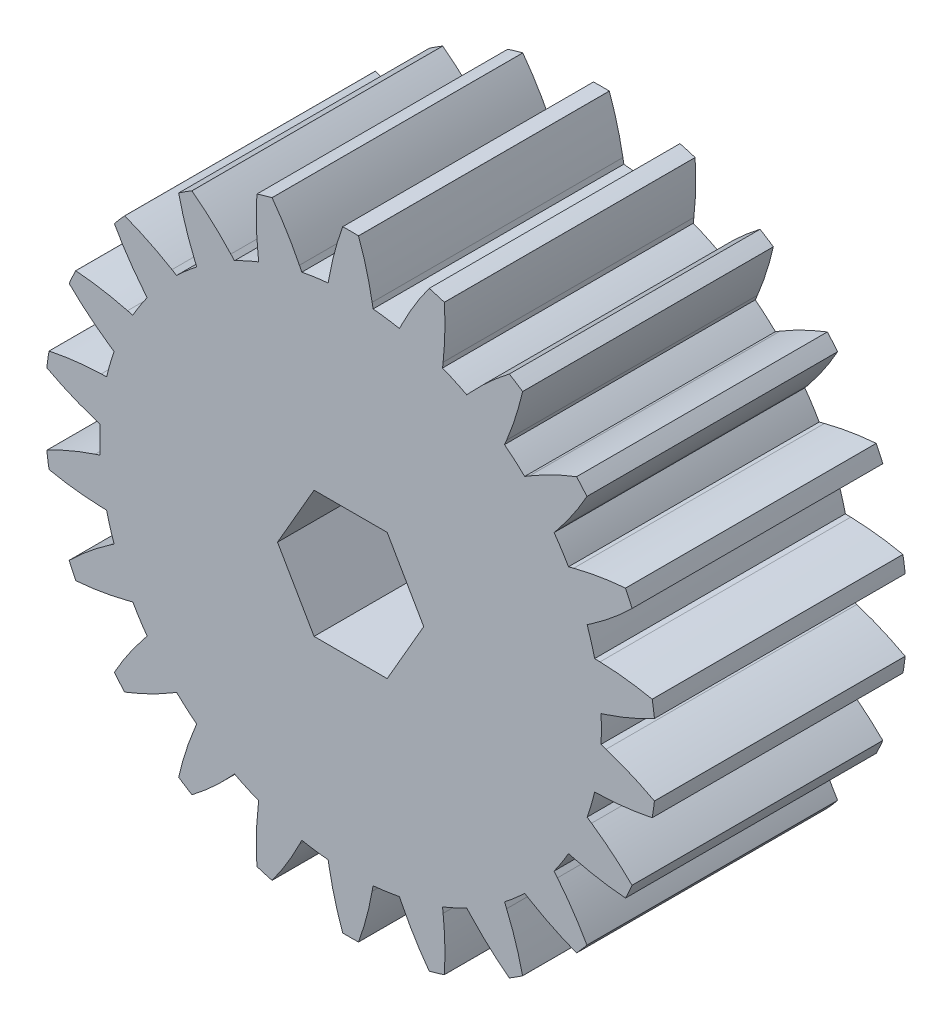
from build123d import *

# Parameters (mm, degrees)
BOSS_EXTRUDE1_DEPTH = 25.4
SKETCH2_OUTSIDE_W   = 81.92
SKETCH2_OUTSIDE_H   = 82.19
SKETCH2_OUTSIDE_R   = 30.988
CUT_EXTRUDE1_DEPTH  = 51.570187972
CHAMFER1_SIZE       = 2.54
FILLET1_R           = 30.48
CUT_EXTRUDE2_DEPTH  = 25.4


with BuildPart() as part:
    # Sketch1 → Boss-Extrude1 (new body)
    with BuildSketch(Plane.XY):
        with BuildLine():
            Line((-2.273288832, 25.298066287), (-1.27, 30.988))
            Line((-1.27, 30.988), (1.27, 30.988))
            Line((1.27, 30.988), (2.273288832, 25.298066287))
            ThreePointArc((2.273288832, 25.298066287), (3.614796892, 25.141464624), (4.946084237, 24.913776324))
            Line((4.946084237, 24.913776324), (7.511772395, 30.090568614))
            Line((7.511772395, 30.090568614), (9.948884548, 29.374967919))
            Line((9.948884548, 29.374967919), (9.30849356, 23.632857374))
            ThreePointArc((9.30849356, 23.632857374), (10.55154133, 23.104652682), (11.764754977, 22.511120371))
            Line((11.764754977, 22.511120371), (15.684985665, 26.755378314))
            Line((15.684985665, 26.755378314), (17.821769638, 25.382150637))
            Line((17.821769638, 25.382150637), (15.589579499, 20.053054906))
            ThreePointArc((15.589579499, 20.053054906), (16.633462642, 19.196039189), (17.630315236, 18.284747324))
            Line((17.630315236, 18.284747324), (22.587494678, 21.252626383))
            Line((22.587494678, 21.252626383), (24.250840942, 19.333022464))
            Line((24.250840942, 19.333022464), (20.607690422, 14.848673189))
            ThreePointArc((20.607690422, 14.848673189), (21.367839734, 13.732276763), (22.067572206, 12.577052792))
            Line((22.067572206, 12.577052792), (27.660099206, 14.028113057))
            Line((27.660099206, 14.028113057), (28.715253339, 11.717647789))
            Line((28.715253339, 11.717647789), (23.956288825, 8.44134028))
            ThreePointArc((23.956288825, 8.44134028), (24.37112153, 7.156006944), (24.717045717, 5.850440242))
            Line((24.717045717, 5.850440242), (30.491846996, 5.66712544))
            Line((30.491846996, 5.66712544), (30.853326686, 3.152978977))
            Line((30.853326686, 3.152978977), (25.364091182, 1.350140183))
            ThreePointArc((25.364091182, 1.350140183), (25.4, 0), (25.364091182, -1.350140183))
            Line((25.364091182, -1.350140183), (30.853326686, -3.152978977))
            Line((30.853326686, -3.152978977), (30.491846996, -5.66712544))
            Line((30.491846996, -5.66712544), (24.717045717, -5.850440242))
            ThreePointArc((24.717045717, -5.850440242), (24.37112153, -7.156006944), (23.956288825, -8.44134028))
            Line((23.956288825, -8.44134028), (28.715253339, -11.717647789))
            Line((28.715253339, -11.717647789), (27.660099206, -14.028113057))
            Line((27.660099206, -14.028113057), (22.067572206, -12.577052792))
            ThreePointArc((22.067572206, -12.577052792), (21.367839734, -13.732276763), (20.607690422, -14.848673189))
            Line((20.607690422, -14.848673189), (24.250840942, -19.333022464))
            Line((24.250840942, -19.333022464), (22.587494678, -21.252626383))
            Line((22.587494678, -21.252626383), (17.630315236, -18.284747324))
            ThreePointArc((17.630315236, -18.284747324), (16.633462642, -19.196039189), (15.589579499, -20.053054906))
            Line((15.589579499, -20.053054906), (17.821769638, -25.382150637))
            Line((17.821769638, -25.382150637), (15.684985665, -26.755378314))
            Line((15.684985665, -26.755378314), (11.764754977, -22.511120371))
            ThreePointArc((11.764754977, -22.511120371), (10.55154133, -23.104652682), (9.30849356, -23.632857374))
            Line((9.30849356, -23.632857374), (9.948884548, -29.374967919))
            Line((9.948884548, -29.374967919), (7.511772395, -30.090568614))
            Line((7.511772395, -30.090568614), (4.946084237, -24.913776324))
            ThreePointArc((4.946084237, -24.913776324), (3.614796892, -25.141464624), (2.273288832, -25.298066287))
            Line((2.273288832, -25.298066287), (1.27, -30.988))
            Line((1.27, -30.988), (-1.27, -30.988))
            Line((-1.27, -30.988), (-2.273288832, -25.298066287))
            ThreePointArc((-2.273288832, -25.298066287), (-3.614796892, -25.141464624), (-4.946084237, -24.913776324))
            Line((-4.946084237, -24.913776324), (-7.511772395, -30.090568614))
            Line((-7.511772395, -30.090568614), (-9.948884548, -29.374967919))
            Line((-9.948884548, -29.374967919), (-9.30849356, -23.632857374))
            ThreePointArc((-9.30849356, -23.632857374), (-10.55154133, -23.104652682), (-11.764754977, -22.511120371))
            Line((-11.764754977, -22.511120371), (-15.684985665, -26.755378314))
            Line((-15.684985665, -26.755378314), (-17.821769638, -25.382150637))
            Line((-17.821769638, -25.382150637), (-15.589579499, -20.053054906))
            ThreePointArc((-15.589579499, -20.053054906), (-16.633462642, -19.196039189), (-17.630315236, -18.284747324))
            Line((-17.630315236, -18.284747324), (-22.587494678, -21.252626383))
            Line((-22.587494678, -21.252626383), (-24.250840942, -19.333022464))
            Line((-24.250840942, -19.333022464), (-20.607690422, -14.848673189))
            ThreePointArc((-20.607690422, -14.848673189), (-21.367839734, -13.732276763), (-22.067572206, -12.577052792))
            Line((-22.067572206, -12.577052792), (-27.660099206, -14.028113057))
            Line((-27.660099206, -14.028113057), (-28.715253339, -11.717647789))
            Line((-28.715253339, -11.717647789), (-23.956288825, -8.44134028))
            ThreePointArc((-23.956288825, -8.44134028), (-24.37112153, -7.156006944), (-24.717045717, -5.850440242))
            Line((-24.717045717, -5.850440242), (-30.491846996, -5.66712544))
            Line((-30.491846996, -5.66712544), (-30.853326686, -3.152978977))
            Line((-30.853326686, -3.152978977), (-25.364091182, -1.350140183))
            ThreePointArc((-25.364091182, -1.350140183), (-25.4, 0), (-25.364091182, 1.350140183))
            Line((-25.364091182, 1.350140183), (-30.853326686, 3.152978977))
            Line((-30.853326686, 3.152978977), (-30.491846996, 5.66712544))
            Line((-30.491846996, 5.66712544), (-24.717045717, 5.850440242))
            ThreePointArc((-24.717045717, 5.850440242), (-24.37112153, 7.156006944), (-23.956288825, 8.44134028))
            Line((-23.956288825, 8.44134028), (-28.715253339, 11.717647789))
            Line((-28.715253339, 11.717647789), (-27.660099206, 14.028113057))
            Line((-27.660099206, 14.028113057), (-22.067572206, 12.577052792))
            ThreePointArc((-22.067572206, 12.577052792), (-21.367839734, 13.732276763), (-20.607690422, 14.848673189))
            Line((-20.607690422, 14.848673189), (-24.250840942, 19.333022464))
            Line((-24.250840942, 19.333022464), (-22.587494678, 21.252626383))
            Line((-22.587494678, 21.252626383), (-17.630315236, 18.284747324))
            ThreePointArc((-17.630315236, 18.284747324), (-16.633462642, 19.196039189), (-15.589579499, 20.053054906))
            Line((-15.589579499, 20.053054906), (-17.821769638, 25.382150637))
            Line((-17.821769638, 25.382150637), (-15.684985665, 26.755378314))
            Line((-15.684985665, 26.755378314), (-11.764754977, 22.511120371))
            ThreePointArc((-11.764754977, 22.511120371), (-10.55154133, 23.104652682), (-9.30849356, 23.632857374))
            Line((-9.30849356, 23.632857374), (-9.948884548, 29.374967919))
            Line((-9.948884548, 29.374967919), (-7.511772395, 30.090568614))
            Line((-7.511772395, 30.090568614), (-4.946084237, 24.913776324))
            ThreePointArc((-4.946084237, 24.913776324), (-3.614796892, 25.141464624), (-2.273288832, 25.298066287))
        make_face()
    extrude(amount=BOSS_EXTRUDE1_DEPTH)

    # Sketch2 outside → Cut-Extrude1 (cut, through all)
    with BuildSketch(Plane.XY.offset(25.4)):
        Rectangle(SKETCH2_OUTSIDE_W, SKETCH2_OUTSIDE_H)
        Circle(SKETCH2_OUTSIDE_R, mode=Mode.SUBTRACT)
    extrude(amount=-CUT_EXTRUDE1_DEPTH, mode=Mode.SUBTRACT)

    # Chamfer1
    # the kernel refuses this chamfer: 2.54, 0.476916629 mm, written as the material it takes off along each edge
    with BuildSketch(Plane(origin=(-7.499946846, 30.066708189, -6.600288543), x_dir=(0.4440666126057047, -0.8959937742913703, 0), z_dir=(0, 0, 1)), Plane(origin=(-22.564646474, 21.238947091, -6.600288543), x_dir=(0.8579834132349209, -0.5136773915735, 0), z_dir=(0, 0, 1)), Plane(origin=(-27.634322612, 14.021424955, -6.600288543), x_dir=(0.9679487013963278, -0.2511479871811889, 0), z_dir=(0, 0, 1)), Plane(origin=(-30.46523028, 5.667970358, -6.600288543), x_dir=(0.9994965423831886, 0.03172793349795939, 0), z_dir=(0, 0, 1)), Plane(origin=(-30.828026174, -3.144669488, -6.600288543), x_dir=(0.9500711177409771, 0.31203344569839025, 0), z_dir=(0, 0, 1)), Plane(origin=(-28.693318729, -11.702546915, -6.600288543), x_dir=(0.8236765814298862, 0.5670598638626932, 0), z_dir=(0, 0, 1)), Plane(origin=(-24.234049247, -19.312353588, -6.600288543), x_dir=(0.6305526670845901, 0.776146464291702, 0), z_dir=(0, 0, 1)), Plane(origin=(-17.81148122, -25.357588228, -6.600288543), x_dir=(0.3863451256931978, 0.9223542941045525, 0), z_dir=(0, 0, 1)), Plane(origin=(-9.945932913, -29.348501878, -6.600288543), x_dir=(0.11083819990105796, 0.9938384644612489, 0), z_dir=(0, 0, 1)), Plane(origin=(-1.274624272, -30.961774448, -6.600288543), x_dir=(-0.1736481776668918, 0.9848077530122149, 0), z_dir=(0, 0, 1)), Plane(origin=(7.499946846, -30.066708189, -6.600288543), x_dir=(-0.44406661260571395, 0.8959937742913657, 0), z_dir=(0, 0, 1)), Plane(origin=(15.666916875, -26.735816046, -6.600288543), x_dir=(-0.6785094115571405, 0.7345917086575257, 0), z_dir=(0, 0, 1)), Plane(origin=(22.564646474, -21.238947091, -6.600288543), x_dir=(-0.8579834132349822, 0.5136773915733978, 0), z_dir=(0, 0, 1)), Plane(origin=(27.634322612, -14.021424955, -6.600288543), x_dir=(-0.9679487013963594, 0.2511479871810671, 0), z_dir=(0, 0, 1)), Plane(origin=(30.46523028, -5.667970358, -6.600288543), x_dir=(-0.9994965423831847, -0.03172793349808035, 0), z_dir=(0, 0, 1)), Plane(origin=(30.828026174, 3.144669488, -6.600288543), x_dir=(-0.9500711177409777, -0.31203344569838826, 0), z_dir=(0, 0, 1)), Plane(origin=(28.693318729, 11.702546915, -6.600288543), x_dir=(-0.823676581429892, -0.5670598638626849, 0), z_dir=(0, 0, 1)), Plane(origin=(24.234049247, 19.312353588, -6.600288543), x_dir=(-0.6305526670846017, -0.7761464642916925, 0), z_dir=(0, 0, 1)), Plane(origin=(17.81148122, 25.357588228, -6.600288543), x_dir=(-0.3863451256932244, -0.9223542941045413, 0), z_dir=(0, 0, 1)), Plane(origin=(9.945932913, 29.348501878, -6.600288543), x_dir=(-0.1108381999011183, -0.9938384644612422, 0), z_dir=(0, 0, 1)), Plane(origin=(1.274624272, 30.961774448, -6.600288543), x_dir=(0.1736481776669276, -0.9848077530122086, 0), z_dir=(0, 0, 1))) as chamfer1_piece_1:
        with BuildLine():
            Line((CHAMFER1_SIZE, 0), (-0.098180868, -0.465182467))
            ThreePointArc((-0.098180868, -0.465182467), (-0.053887012, -0.250930237), (0, 0))
            Line((0, 0), (CHAMFER1_SIZE, 0))
        make_face()
    extrude(amount=38.600577086, mode=Mode.SUBTRACT)
    with BuildSketch(Plane(origin=(-1.274624272, 30.961774448, -6.600288543), x_dir=(0.9994398259990054, 0.03346691212343495, 0), z_dir=(0, 0, 1)), Plane(origin=(-9.945932913, 29.348501878, -6.600288543), x_dir=(0.9495267718744262, 0.3136860046188405, 0), z_dir=(0, 0, 1)), Plane(origin=(-17.81148122, 25.357588228, -6.600288543), x_dir=(0.8226887057457318, 0.5684921225825494, 0), z_dir=(0, 0, 1)), Plane(origin=(-24.234049247, 19.312353588, -6.600288543), x_dir=(0.6292012933956386, 0.7772423897274617, 0), z_dir=(0, 0, 1)), Plane(origin=(-28.693318729, 11.702546915, -6.600288543), x_dir=(0.3847397342588159, 0.923025100895125, 0), z_dir=(0, 0, 1)), Plane(origin=(-30.828026174, 3.144669488, -6.600288543), x_dir=(0.10910884998763513, 0.9940298078299139, 0), z_dir=(0, 0, 1)), Plane(origin=(-30.46523028, -5.667970358, -6.600288543), x_dir=(-0.17536138441422428, 0.9845041314572156, 0), z_dir=(0, 0, 1)), Plane(origin=(-27.634322612, -14.021424955, -6.600288543), x_dir=(-0.4456248823651576, 0.8952197854253666, 0), z_dir=(0, 0, 1)), Plane(origin=(-22.564646474, -21.238947091, -6.600288543), x_dir=(-0.6797865025800756, 0.7334100564554246, 0), z_dir=(0, 0, 1)), Plane(origin=(-15.666916875, -26.735816046, -6.600288543), x_dir=(-0.8588758632019615, 0.5121838064690113, 0), z_dir=(0, 0, 1)), Plane(origin=(-7.499946846, -30.066708189, -6.600288543), x_dir=(-0.9683842093186641, 0.24946347055684484, 0), z_dir=(0, 0, 1)), Plane(origin=(1.274624272, -30.961774448, -6.600288543), x_dir=(-0.999439825999006, -0.033466912123419526, 0), z_dir=(0, 0, 1)), Plane(origin=(9.945932913, -29.348501878, -6.600288543), x_dir=(-0.9495267718744267, -0.31368600461883944, 0), z_dir=(0, 0, 1)), Plane(origin=(17.81148122, -25.357588228, -6.600288543), x_dir=(-0.8226887057457212, -0.568492122582565, 0), z_dir=(0, 0, 1)), Plane(origin=(24.234049247, -19.312353588, -6.600288543), x_dir=(-0.6292012933956287, -0.7772423897274697, 0), z_dir=(0, 0, 1)), Plane(origin=(28.693318729, -11.702546915, -6.600288543), x_dir=(-0.384739734258791, -0.9230251008951355, 0), z_dir=(0, 0, 1)), Plane(origin=(30.828026174, -3.144669488, -6.600288543), x_dir=(-0.10910884998760988, -0.9940298078299168, 0), z_dir=(0, 0, 1)), Plane(origin=(30.46523028, 5.667970358, -6.600288543), x_dir=(0.17536138441422688, -0.9845041314572153, 0), z_dir=(0, 0, 1)), Plane(origin=(27.634322612, 14.021424955, -6.600288543), x_dir=(0.4456248823651427, -0.8952197854253741, 0), z_dir=(0, 0, 1)), Plane(origin=(22.564646474, 21.238947091, -6.600288543), x_dir=(0.6797865025800716, -0.7334100564554282, 0), z_dir=(0, 0, 1)), Plane(origin=(15.666916875, 26.735816046, -6.600288543), x_dir=(0.8588758632019563, -0.5121838064690201, 0), z_dir=(0, 0, 1)), Plane(origin=(7.499946846, 30.066708189, -6.600288543), x_dir=(0.9683842093186579, -0.24946347055686904, 0), z_dir=(0, 0, 1))) as chamfer1_piece_2:
        with BuildLine():
            Line((0.475430553, 0), (-CHAMFER1_SIZE * 0.206509379001, -CHAMFER1_SIZE * 0.978444621011))
            Line((-CHAMFER1_SIZE * 0.206509379001, -CHAMFER1_SIZE * 0.978444621011), (0, 0))
            ThreePointArc((0, 0), (0.256649514, 0.00090601), (0.475430553, 0))
        make_face()
    extrude(amount=38.600577086, mode=Mode.SUBTRACT)
    with BuildSketch(Plane(origin=(-15.666916875, 26.735816046, -6.600288543), x_dir=(-0.8588758632019761, -0.5121838064689869, 0), z_dir=(0, 0, 1))) as chamfer1_piece_3:
        with BuildLine():
            Line((0.475430553, 0), (-CHAMFER1_SIZE * 0.206509379001, CHAMFER1_SIZE * 0.978444621011))
            Line((-CHAMFER1_SIZE * 0.206509379001, CHAMFER1_SIZE * 0.978444621011), (0, 0))
            ThreePointArc((0, 0), (0.256649514, -0.00090601), (0.475430553, 0))
        make_face()
    extrude(amount=38.600577086, mode=Mode.SUBTRACT)

    # Fillet1
    fillet1_edges = [part.edges().sort_by_distance(p)[0] for p in [
        (-20.385368604, 19.934206516, 12.7),
        (-22.632445472, 17.340941569, 12.7),
        (-25.175732911, 13.383509068, 12.7),
        (-26.601180213, 10.26221486, 12.7),
        (-27.926509062, 5.748559309, 12.7),
        (-28.414845535, 2.352104536, 12.7),
        (-28.414845535, -2.352104536, 12.7),
        (-27.926509062, -5.748559309, 12.7),
        (-26.601180213, -10.26221486, 12.7),
        (-25.175732911, -13.383509068, 12.7),
        (-22.632445472, -17.340941569, 12.7),
        (-20.385368604, -19.934206516, 12.7),
        (-16.8301646, -23.014808321, 12.7),
        (-13.94350297, -24.869953106, 12.7),
        (-9.664403885, -26.824152178, 12.7),
        (-6.37201765, -27.790884002, 12.7),
        (-1.715690644, -28.460362755, 12.7),
        (1.715690644, -28.460362755, 12.7),
        (6.37201765, -27.790884002, 12.7),
        (9.664403885, -26.824152178, 12.7),
        (13.94350297, -24.869953106, 12.7),
        (16.8301646, -23.014808321, 12.7),
        (20.385368604, -19.934206516, 12.7),
        (22.632445472, -17.340941569, 12.7),
        (25.175732911, -13.383509068, 12.7),
        (26.601180213, -10.26221486, 12.7),
        (27.926509062, -5.748559309, 12.7),
        (28.414845535, -2.352104536, 12.7),
        (28.414845535, 2.352104536, 12.7),
        (27.926509062, 5.748559309, 12.7),
        (26.601180213, 10.26221486, 12.7),
        (25.175732911, 13.383509068, 12.7),
        (22.632445472, 17.340941569, 12.7),
        (20.385368604, 19.934206516, 12.7),
        (16.8301646, 23.014808321, 12.7),
        (13.94350297, 24.869953106, 12.7),
        (9.664403885, 26.824152178, 12.7),
        (6.37201765, 27.790884002, 12.7),
        (1.715690644, 28.460362755, 12.7),
        (-1.715690644, 28.460362755, 12.7),
        (-6.37201765, 27.790884002, 12.7),
        (-9.664403885, 26.824152178, 12.7),
        (-16.8301646, 23.014808321, 12.7),
        (-13.94350297, 24.869953106, 12.7),
    ]]
    fillet(fillet1_edges, radius=FILLET1_R)

    # Sketch3 → Cut-Extrude2 (cut)
    with BuildSketch(Plane.XY.offset(25.4)):
        Polygon((3.702835951, 6.4135), (-3.702835951, 6.4135), (-7.405671903, 0), (-3.702835951, -6.4135), (3.702835951, -6.4135), (7.405671903, 0), align=None)
    extrude(amount=-CUT_EXTRUDE2_DEPTH, mode=Mode.SUBTRACT)


solid = part.part
